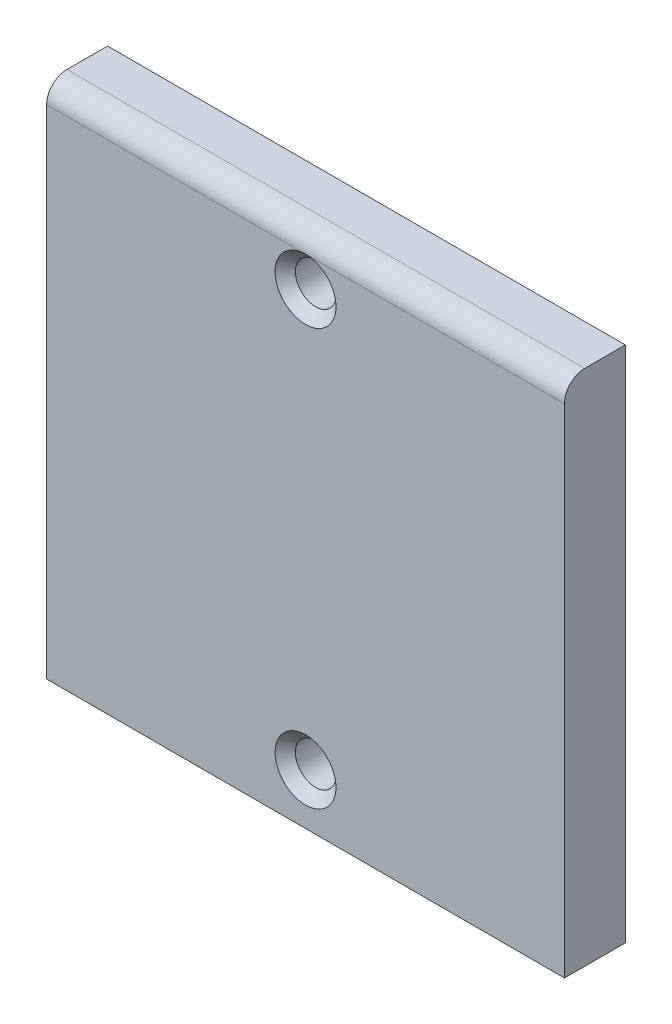
from build123d import *

# Parameters (mm, degrees)
ESBO_O1_W                = 51
ESBO_O1_H                = 51
RESSALTO_EXTRUS_O1_DEPTH = 6
ESBO_O2_W                = 6.5
ESBO_O2_H                = 36.5
CORTE_EXTRUS_O1_DEPTH    = 4.5
ESBO_O3_R                = 2
CORTE_EXTRUS_O2_DEPTH    = 37.558172821
CORTE_EXTRUS_O3_DEPTH    = 4.5
PADR_O_LINEAR1_COUNT     = 3
PADR_O_LINEAR1_PITCH     = 10
FILETE1_R                = 2
CHANFRO1_SIZE            = 1


with BuildPart() as part:
    # Esboço1 → Ressalto-extrusão1 (new body)
    with BuildSketch(Plane.XY):
        Rectangle(ESBO_O1_W, ESBO_O1_H)
    extrude(amount=RESSALTO_EXTRUS_O1_DEPTH)

    # Esboço2 → Corte-extrusão1 (cut)
    with BuildSketch(Plane(origin=(0, 0, 0), x_dir=(-1, 0, 0), z_dir=(0, 0, -1))):
        with Locations((-20.85, -5.85)):
            Rectangle(ESBO_O2_W, ESBO_O2_H)
    extrude(amount=-CORTE_EXTRUS_O1_DEPTH, mode=Mode.SUBTRACT)

    # Esboço3 → Corte-extrusão2 (cut, through all)
    with BuildSketch(Plane.XY.offset(6)):
        with Locations((0, -20.5)):
            Circle(ESBO_O3_R)
        with Locations((0, 20.5)):
            Circle(ESBO_O3_R)
    extrude(amount=-CORTE_EXTRUS_O2_DEPTH, mode=Mode.SUBTRACT)

    # Esboço4 → Corte-extrusão3 (cut)
    with BuildSketch(Plane(origin=(0, 0, 0), x_dir=(-1, 0, 0), z_dir=(0, 0, -1))):
        Polygon((-14.732145215, 17.5), (23.332781841, -0.249966993), (22.064927056, -2.968890354), (-16, 14.781076639), align=None)
    corte_extrus_o3 = extrude(amount=-CORTE_EXTRUS_O3_DEPTH, mode=Mode.SUBTRACT)

    # Padrão linear1: Corte-extrusão3 ×3
    with Locations(*[(0, -i * PADR_O_LINEAR1_PITCH, 0) for i in range(1, PADR_O_LINEAR1_COUNT)]):
        add(corte_extrus_o3, mode=Mode.SUBTRACT)

    # Filete1
    filete1_edges = [part.edges().sort_by_distance(p)[0] for p in [
        (0, 25.5, 6),
    ]]
    fillet(filete1_edges, radius=FILETE1_R)

    # Chanfro1
    chanfro1_edges = [part.edges().sort_by_distance(p)[0] for p in [
        (-2, -20.5, 6),
        (-2, 20.5, 6),
    ]]
    chamfer(chanfro1_edges, length=CHANFRO1_SIZE - 0.0001)  # a hair under: the kernel refuses the full size


solid = part.part
